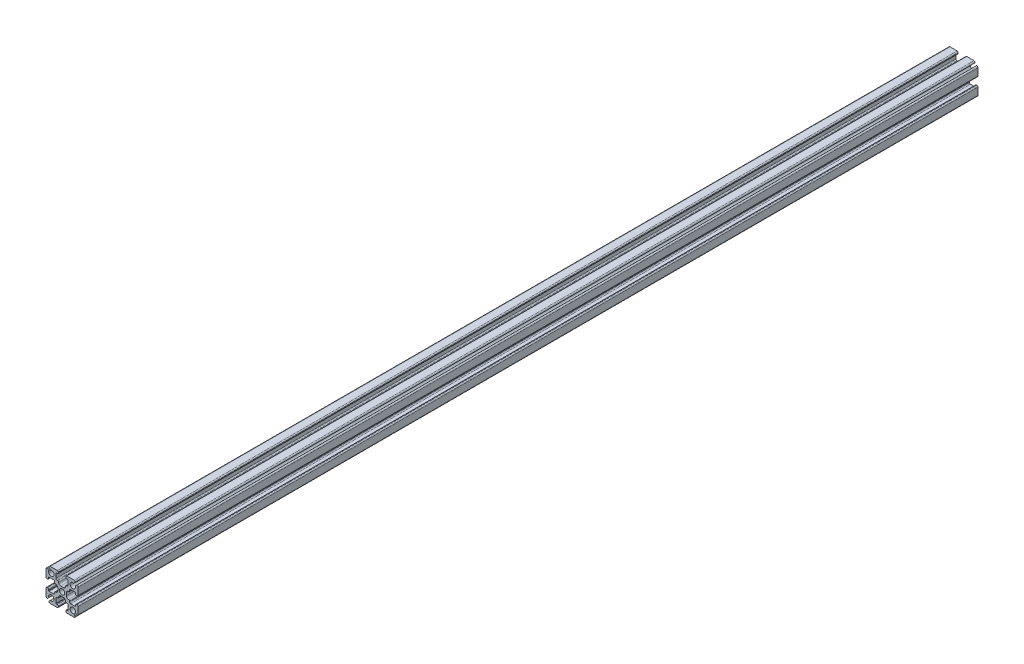
from build123d import *

# Parameters (mm, degrees)
SKETCH1_R           = 1.25
BOSS_EXTRUDE1_DEPTH = 420


with BuildPart() as part:
    # Sketch1 → Boss-Extrude1 (new body)
    with BuildSketch(Plane.XY.offset(420)):
        with BuildLine():
            Line((-5.939339828, 6.646446609), (-5.456539197, 6.163645978))
            ThreePointArc((-5.456539197, 6.163645978), (-4.116116524, 4.116116524), (-6.163645978, 5.456539197))
            Line((-6.163645978, 5.456539197), (-6.646446609, 5.939339828))
            ThreePointArc((-6.646446609, 5.939339828), (-7.191341716, 6.047726204), (-7.5, 5.585786438))
            Line((-7.5, 5.585786438), (-7.5, 2.25))
            ThreePointArc((-7.5, 2.25), (-7.353553391, 1.896446609), (-7, 1.75))
            Line((-7, 1.75), (-6.8, 1.75))
            ThreePointArc((-6.8, 1.75), (-6.446446609, 1.896446609), (-6.3, 2.25))
            Line((-6.3, 2.25), (-6.3, 2.65))
            ThreePointArc((-6.3, 2.65), (-6.241421356, 2.791421356), (-6.1, 2.85))
            Line((-6.1, 2.85), (-4, 2.85))
            ThreePointArc((-4, 2.85), (-3.646446609, 2.703553391), (-3.5, 2.35))
            Line((-3.5, 2.35), (-3.5, 2.1))
            ThreePointArc((-3.5, 2.1), (-3.353553391, 1.746446609), (-3, 1.6))
            ThreePointArc((-3, 1.6), (-2.292893219, 1.307106781), (-2, 0.6))
            Line((-2, 0.6), (-2, -0.6))
            ThreePointArc((-2, -0.6), (-2.292893219, -1.307106781), (-3, -1.6))
            ThreePointArc((-3, -1.6), (-3.353553391, -1.746446609), (-3.5, -2.1))
            Line((-3.5, -2.1), (-3.5, -2.35))
            ThreePointArc((-3.5, -2.35), (-3.646446609, -2.703553391), (-4, -2.85))
            Line((-4, -2.85), (-6.1, -2.85))
            ThreePointArc((-6.1, -2.85), (-6.241421356, -2.791421356), (-6.3, -2.65))
            Line((-6.3, -2.65), (-6.3, -2.25))
            ThreePointArc((-6.3, -2.25), (-6.446446609, -1.896446609), (-6.8, -1.75))
            Line((-6.8, -1.75), (-7, -1.75))
            ThreePointArc((-7, -1.75), (-7.353553391, -1.896446609), (-7.5, -2.25))
            Line((-7.5, -2.25), (-7.5, -5.585786438))
            ThreePointArc((-7.5, -5.585786438), (-7.191341716, -6.047726204), (-6.646446609, -5.939339828))
            Line((-6.646446609, -5.939339828), (-6.163645978, -5.456539197))
            ThreePointArc((-6.163645978, -5.456539197), (-4.116116524, -4.116116524), (-5.456539197, -6.163645978))
            Line((-5.456539197, -6.163645978), (-5.939339828, -6.646446609))
            ThreePointArc((-5.939339828, -6.646446609), (-6.047726204, -7.191341716), (-5.585786438, -7.5))
            Line((-5.585786438, -7.5), (-2.25, -7.5))
            ThreePointArc((-2.25, -7.5), (-1.896446609, -7.353553391), (-1.75, -7))
            Line((-1.75, -7), (-1.75, -6.8))
            ThreePointArc((-1.75, -6.8), (-1.896446609, -6.446446609), (-2.25, -6.3))
            Line((-2.25, -6.3), (-2.65, -6.3))
            ThreePointArc((-2.65, -6.3), (-2.791421356, -6.241421356), (-2.85, -6.1))
            Line((-2.85, -6.1), (-2.85, -4))
            ThreePointArc((-2.85, -4), (-2.703553391, -3.646446609), (-2.35, -3.5))
            Line((-2.35, -3.5), (-2.1, -3.5))
            ThreePointArc((-2.1, -3.5), (-1.746446609, -3.353553391), (-1.6, -3))
            ThreePointArc((-1.6, -3), (-1.307106781, -2.292893219), (-0.6, -2))
            Line((-0.6, -2), (0.6, -2))
            ThreePointArc((0.6, -2), (1.307106781, -2.292893219), (1.6, -3))
            ThreePointArc((1.6, -3), (1.746446609, -3.353553391), (2.1, -3.5))
            Line((2.1, -3.5), (2.35, -3.5))
            ThreePointArc((2.35, -3.5), (2.703553391, -3.646446609), (2.85, -4))
            Line((2.85, -4), (2.85, -6.1))
            ThreePointArc((2.85, -6.1), (2.791421356, -6.241421356), (2.65, -6.3))
            Line((2.65, -6.3), (2.25, -6.3))
            ThreePointArc((2.25, -6.3), (1.896446609, -6.446446609), (1.75, -6.8))
            Line((1.75, -6.8), (1.75, -7))
            ThreePointArc((1.75, -7), (1.896446609, -7.353553391), (2.25, -7.5))
            Line((2.25, -7.5), (5.585786438, -7.5))
            ThreePointArc((5.585786438, -7.5), (6.047726204, -7.191341716), (5.939339828, -6.646446609))
            Line((5.939339828, -6.646446609), (5.456539197, -6.163645978))
            ThreePointArc((5.456539197, -6.163645978), (4.116116524, -4.116116524), (6.163645978, -5.456539197))
            Line((6.163645978, -5.456539197), (6.646446609, -5.939339828))
            ThreePointArc((6.646446609, -5.939339828), (7.191341716, -6.047726204), (7.5, -5.585786438))
            Line((7.5, -5.585786438), (7.5, -2.25))
            ThreePointArc((7.5, -2.25), (7.353553391, -1.896446609), (7, -1.75))
            Line((7, -1.75), (6.8, -1.75))
            ThreePointArc((6.8, -1.75), (6.446446609, -1.896446609), (6.3, -2.25))
            Line((6.3, -2.25), (6.3, -2.65))
            ThreePointArc((6.3, -2.65), (6.241421356, -2.791421356), (6.1, -2.85))
            Line((6.1, -2.85), (4, -2.85))
            ThreePointArc((4, -2.85), (3.646446609, -2.703553391), (3.5, -2.35))
            Line((3.5, -2.35), (3.5, -2.1))
            ThreePointArc((3.5, -2.1), (3.353553391, -1.746446609), (3, -1.6))
            ThreePointArc((3, -1.6), (2.292893219, -1.307106781), (2, -0.6))
            Line((2, -0.6), (2, 0.6))
            ThreePointArc((2, 0.6), (2.292893219, 1.307106781), (3, 1.6))
            ThreePointArc((3, 1.6), (3.353553391, 1.746446609), (3.5, 2.1))
            Line((3.5, 2.1), (3.5, 2.35))
            ThreePointArc((3.5, 2.35), (3.646446609, 2.703553391), (4, 2.85))
            Line((4, 2.85), (6.1, 2.85))
            ThreePointArc((6.1, 2.85), (6.241421356, 2.791421356), (6.3, 2.65))
            Line((6.3, 2.65), (6.3, 2.25))
            ThreePointArc((6.3, 2.25), (6.446446609, 1.896446609), (6.8, 1.75))
            Line((6.8, 1.75), (7, 1.75))
            ThreePointArc((7, 1.75), (7.353553391, 1.896446609), (7.5, 2.25))
            Line((7.5, 2.25), (7.5, 5.585786438))
            ThreePointArc((7.5, 5.585786438), (7.191341716, 6.047726204), (6.646446609, 5.939339828))
            Line((6.646446609, 5.939339828), (6.163645978, 5.456539197))
            ThreePointArc((6.163645978, 5.456539197), (4.116116524, 4.116116524), (5.456539197, 6.163645978))
            Line((5.456539197, 6.163645978), (5.939339828, 6.646446609))
            ThreePointArc((5.939339828, 6.646446609), (6.047726204, 7.191341716), (5.585786438, 7.5))
            Line((5.585786438, 7.5), (2.25, 7.5))
            ThreePointArc((2.25, 7.5), (1.896446609, 7.353553391), (1.75, 7))
            Line((1.75, 7), (1.75, 6.8))
            ThreePointArc((1.75, 6.8), (1.896446609, 6.446446609), (2.25, 6.3))
            Line((2.25, 6.3), (2.65, 6.3))
            ThreePointArc((2.65, 6.3), (2.791421356, 6.241421356), (2.85, 6.1))
            Line((2.85, 6.1), (2.85, 4))
            ThreePointArc((2.85, 4), (2.703553391, 3.646446609), (2.35, 3.5))
            Line((2.35, 3.5), (2.1, 3.5))
            ThreePointArc((2.1, 3.5), (1.746446609, 3.353553391), (1.6, 3))
            ThreePointArc((1.6, 3), (1.307106781, 2.292893219), (0.6, 2))
            Line((0.6, 2), (-0.6, 2))
            ThreePointArc((-0.6, 2), (-1.307106781, 2.292893219), (-1.6, 3))
            ThreePointArc((-1.6, 3), (-1.746446609, 3.353553391), (-2.1, 3.5))
            Line((-2.1, 3.5), (-2.35, 3.5))
            ThreePointArc((-2.35, 3.5), (-2.703553391, 3.646446609), (-2.85, 4))
            Line((-2.85, 4), (-2.85, 6.1))
            ThreePointArc((-2.85, 6.1), (-2.791421356, 6.241421356), (-2.65, 6.3))
            Line((-2.65, 6.3), (-2.25, 6.3))
            ThreePointArc((-2.25, 6.3), (-1.896446609, 6.446446609), (-1.75, 6.8))
            Line((-1.75, 6.8), (-1.75, 7))
            ThreePointArc((-1.75, 7), (-1.896446609, 7.353553391), (-2.25, 7.5))
            Line((-2.25, 7.5), (-5.585786438, 7.5))
            ThreePointArc((-5.585786438, 7.5), (-6.047726204, 7.191341716), (-5.939339828, 6.646446609))
        make_face()
        Circle(SKETCH1_R, mode=Mode.SUBTRACT)
    extrude(amount=-BOSS_EXTRUDE1_DEPTH)


solid = part.part
